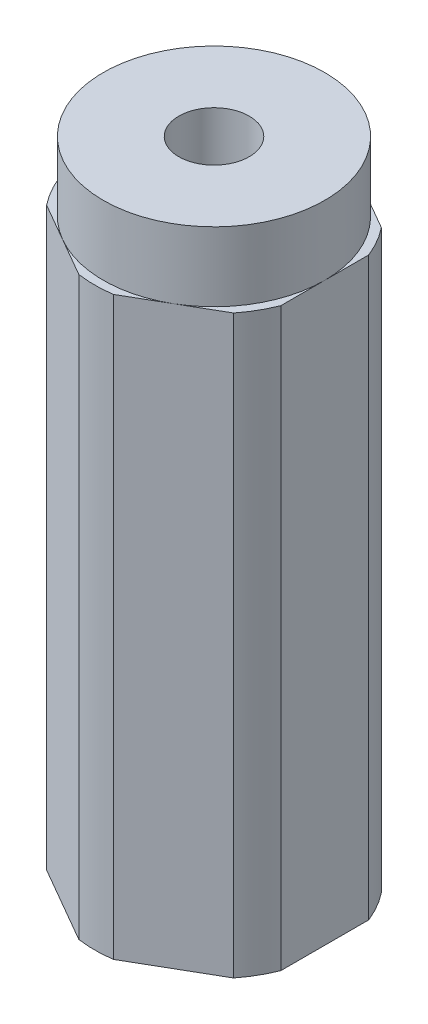
from build123d import *

# Parameters (mm, degrees)
BOSS_EXTRUDE1_DEPTH = 16.51
SKETCH3_R           = 6.35
BOSS_EXTRUDE2_DEPTH = 3.96875
SKETCH2_R           = 2.0193
CUT_EXTRUDE1_DEPTH  = 39.14675018


with BuildPart() as part:
    # Sketch1 → Boss-Extrude1 (new, symmetric)
    with BuildSketch(Plane(origin=(0, 0, 0), x_dir=(1, 0, 0), z_dir=(0, 1, 0))):
        with BuildLine():
            ThreePointArc((0.990636919, 6.760403927), (0, 6.8326), (-0.990636919, 6.760403927))
            Line((-0.990636919, 6.760403927), (-5.359363081, 4.238118701))
            ThreePointArc((-5.359363081, 4.238118701), (-5.917205174, 3.4163), (-6.35, 2.522285226))
            Line((-6.35, 2.522285226), (-6.35, -2.522285226))
            ThreePointArc((-6.35, -2.522285226), (-5.917205174, -3.4163), (-5.359363081, -4.238118701))
            Line((-5.359363081, -4.238118701), (-0.990636919, -6.760403927))
            ThreePointArc((-0.990636919, -6.760403927), (0, -6.8326), (0.990636919, -6.760403927))
            Line((0.990636919, -6.760403927), (5.359363081, -4.238118701))
            ThreePointArc((5.359363081, -4.238118701), (5.917205174, -3.4163), (6.35, -2.522285226))
            Line((6.35, -2.522285226), (6.35, 2.522285226))
            ThreePointArc((6.35, 2.522285226), (5.917205174, 3.4163), (5.359363081, 4.238118701))
            Line((5.359363081, 4.238118701), (0.990636919, 6.760403927))
        make_face()
    extrude(amount=BOSS_EXTRUDE1_DEPTH, both=True)

    # Sketch3 → Boss-Extrude2 (add, symmetric)
    with BuildSketch(Plane(origin=(0, 16.51, 0), x_dir=(1, 0, 0), z_dir=(0, 1, 0))):
        Circle(SKETCH3_R)
    extrude(amount=BOSS_EXTRUDE2_DEPTH, both=True)

    # Sketch2 → Cut-Extrude1 (cut, through all)
    with BuildSketch(Plane(origin=(0, -16.51, 0), x_dir=(1, 0, 0), z_dir=(0, 1, 0))):
        Circle(SKETCH2_R)
    extrude(amount=CUT_EXTRUDE1_DEPTH, mode=Mode.SUBTRACT)


solid = part.part
